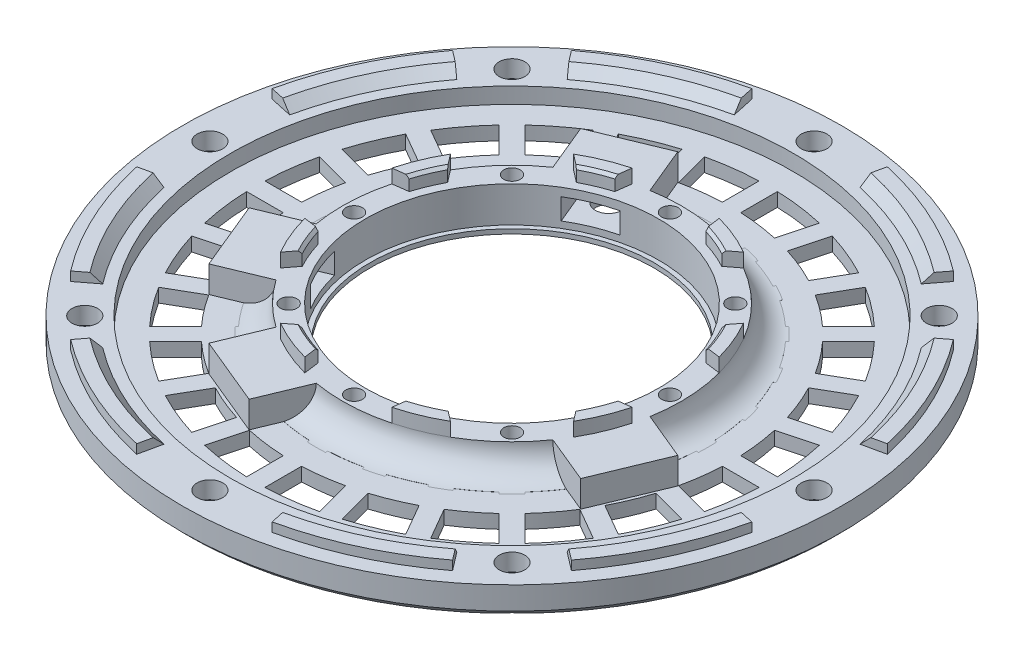
from build123d import *

# Parameters (mm, degrees)
SKETCH1_R                                         = 36
SKETCH1_R_2                                       = 16.025
BOSS_EXTRUDE1_DEPTH                               = 1
SKETCH2_R                                         = 18.5
SKETCH2_R_2                                       = 16.025
BOSS_EXTRUDE2_DEPTH                               = 3.9
FILLET1_R                                         = 2.9
BOSS_EXTRUDE3_START                               = -0.5
SKETCH4_R                                         = 36
SKETCH4_R_2                                       = 15.525
BOSS_EXTRUDE3_DEPTH                               = 0.5
CUT_EXTRUDE1_DEPTH                                = 51.994215358
CUT_EXTRUDE1_DEPTH_BACK                           = 51.994215358
SKETCH22_R                                        = 24.00781141
SKETCH22_R_2                                      = 21.15
BOSS_EXTRUDE10_DEPTH                              = 1.5
SKETCH7_R                                         = 0.9
CUT_EXTRUDE2_DEPTH                                = 52.101467689
SKETCH8_R                                         = 36
SKETCH8_R_2                                       = 30.75
BOSS_EXTRUDE4_DEPTH                               = 1.7378
BOSS_EXTRUDE5_DEPTH                               = 1
CIRPATTERN1_COUNT                                 = 4
CHAMFER1_SIZE                                     = 1
CUT_EXTRUDE3_DEPTH                                = 52.014540563
CUT_EXTRUDE3_DEPTH_BACK                           = 52.014540563
SKETCH10_R                                        = 1.4
CHAMFER2_SIZE                                     = 0.75
CSK_FOR_M2_5_FLAT_HEAD_MACHINE_SCREW1_D           = 2.7
CSK_FOR_M2_5_FLAT_HEAD_MACHINE_SCREW1_CSINK_D     = 5.5
CSK_FOR_M2_5_FLAT_HEAD_MACHINE_SCREW1_CSINK_ANGLE = 90
BOSS_EXTRUDE6_DEPTH                               = 1.5
CHAMFER3_SIZE                                     = 0.3
BOSS_EXTRUDE7_DEPTH                               = 2.9
SKETCH14_R                                        = 1.45
CUT_EXTRUDE4_DEPTH                                = 3.5
CUT_EXTRUDE7_DEPTH                                = 2.3


with BuildPart() as part:
    # Sketch1 → Boss-Extrude1 (new body)
    with BuildSketch(Plane(origin=(0, 0, 0), x_dir=(1, 0, 0), z_dir=(0, 1, 0))):
        with Locations(Location((0, 0, 0), (0, 0, 270))):
            Circle(SKETCH1_R)
        with Locations(Location((0, 0, 0), (0, 0, 270))):
            Circle(SKETCH1_R_2, mode=Mode.SUBTRACT)
    extrude(amount=BOSS_EXTRUDE1_DEPTH)

    # Sketch2 → Boss-Extrude2 (add)
    with BuildSketch(Plane.XZ):
        with Locations(Location((0, 0, 0), (0, 0, 270))):
            Circle(SKETCH2_R)
        with Locations(Location((0, 0, 0), (0, 0, 90))):
            Circle(SKETCH2_R_2, mode=Mode.SUBTRACT)
    extrude(amount=-BOSS_EXTRUDE2_DEPTH)

    # Fillet1
    fillet1_edges = [part.edges().sort_by_distance(p)[0] for p in [
        (0, 1, 18.5),
    ]]
    fillet(fillet1_edges, radius=FILLET1_R - 0.0001)  # a hair under: the kernel refuses the full size

    # Sketch4 → Boss-Extrude3 (add)
    with BuildSketch(Plane(origin=(0, 0, 0), x_dir=(1, 0, 0), z_dir=(0, 1, 0)).offset(BOSS_EXTRUDE3_START)):
        with Locations(Location((0, 0, 0), (0, 0, 270))):
            Circle(SKETCH4_R)
        with Locations(Location((0, 0, 0), (0, 0, 270))):
            Circle(SKETCH4_R_2, mode=Mode.SUBTRACT)
    extrude(amount=BOSS_EXTRUDE3_DEPTH)

    # Sketch5 → Cut-Extrude1 (cut, two sides: drawn at the far end of the back side and taken through both)
    with BuildSketch(Plane(origin=(0, 1, 0), x_dir=(1, 0, 0), z_dir=(0, 1, 0)).offset(-CUT_EXTRUDE1_DEPTH_BACK)):
        with BuildLine():
            Line((27.989953555, 1), (21.126346111, 1))
            ThreePointArc((21.126346111, 1), (20.969058818, 2.760628965), (20.665302369, 4.501974901))
            Line((20.665302369, 4.501974901), (27.29503806, 6.278407225))
            ThreePointArc((27.29503806, 6.278407225), (27.768200701, 3.655752976), (27.989953555, 1))
        make_face()
        with BuildLine():
            Line((27.989953555, -1), (21.126346111, -1))
            ThreePointArc((21.126346111, -1), (20.969058818, -2.760628965), (20.665302369, -4.501974901))
            Line((20.665302369, -4.501974901), (27.29503806, -6.278407225))
            ThreePointArc((27.29503806, -6.278407225), (27.768200701, -3.655752976), (27.989953555, -1))
        make_face()
        with BuildLine():
            Line((26.77739997, -8.210258878), (20.147664279, -6.433826553))
            ThreePointArc((20.147664279, -6.433826553), (19.540052113, -8.093754595), (18.795952421, -9.697147652))
            Line((18.795952421, -9.697147652), (24.740010829, -13.128951374))
            ThreePointArc((24.740010829, -13.128951374), (25.875843712, -10.718125404), (26.77739997, -8.210258878))
        make_face()
        with BuildLine():
            Line((23.740010829, -14.861002181), (17.795952421, -11.429198459))
            ThreePointArc((17.795952421, -11.429198459), (16.779423147, -12.875304224), (15.645689378, -14.231475816))
            Line((15.645689378, -14.231475816), (20.498992745, -19.084779183))
            ThreePointArc((20.498992745, -19.084779183), (22.220090737, -17.050075298), (23.740010829, -14.861002181))
        make_face()
        with BuildLine():
            Line((19.084779183, -20.498992745), (14.231475816, -15.645689378))
            ThreePointArc((14.231475816, -15.645689378), (12.875304224, -16.779423147), (11.429198459, -17.795952421))
            Line((11.429198459, -17.795952421), (14.861002181, -23.740010829))
            ThreePointArc((14.861002181, -23.740010829), (17.050075298, -22.220090737), (19.084779183, -20.498992745))
        make_face()
        with BuildLine():
            Line((13.128951374, -24.740010829), (9.697147652, -18.795952421))
            ThreePointArc((9.697147652, -18.795952421), (8.093754595, -19.540052113), (6.433826553, -20.147664279))
            Line((6.433826553, -20.147664279), (8.210258878, -26.77739997))
            ThreePointArc((8.210258878, -26.77739997), (10.718125404, -25.875843712), (13.128951374, -24.740010829))
        make_face()
        with BuildLine():
            Line((6.278407225, -27.29503806), (4.501974901, -20.665302369))
            ThreePointArc((4.501974901, -20.665302369), (2.760628965, -20.969058818), (1, -21.126346111))
            Line((1, -21.126346111), (1, -27.989953555))
            ThreePointArc((1, -27.989953555), (3.655752976, -27.768200701), (6.278407225, -27.29503806))
        make_face()
        with BuildLine():
            Line((-1, -27.989953555), (-1, -21.126346111))
            ThreePointArc((-1, -21.126346111), (-2.760628965, -20.969058818), (-4.501974901, -20.665302369))
            Line((-4.501974901, -20.665302369), (-6.278407225, -27.29503806))
            ThreePointArc((-6.278407225, -27.29503806), (-3.655752976, -27.768200701), (-1, -27.989953555))
        make_face()
        with BuildLine():
            Line((-8.210258878, -26.77739997), (-6.433826553, -20.147664279))
            ThreePointArc((-6.433826553, -20.147664279), (-8.093754595, -19.540052113), (-9.697147652, -18.795952421))
            Line((-9.697147652, -18.795952421), (-13.128951374, -24.740010829))
            ThreePointArc((-13.128951374, -24.740010829), (-10.718125404, -25.875843712), (-8.210258878, -26.77739997))
        make_face()
        with BuildLine():
            Line((-14.861002181, -23.740010829), (-11.429198459, -17.795952421))
            ThreePointArc((-11.429198459, -17.795952421), (-12.875304224, -16.779423147), (-14.231475816, -15.645689378))
            Line((-14.231475816, -15.645689378), (-19.084779183, -20.498992745))
            ThreePointArc((-19.084779183, -20.498992745), (-17.050075298, -22.220090737), (-14.861002181, -23.740010829))
        make_face()
        with BuildLine():
            Line((-20.498992745, -19.084779183), (-15.645689378, -14.231475816))
            ThreePointArc((-15.645689378, -14.231475816), (-16.779423147, -12.875304224), (-17.795952421, -11.429198459))
            Line((-17.795952421, -11.429198459), (-23.740010829, -14.861002181))
            ThreePointArc((-23.740010829, -14.861002181), (-22.220090737, -17.050075298), (-20.498992745, -19.084779183))
        make_face()
        with BuildLine():
            Line((-24.740010829, -13.128951374), (-18.795952421, -9.697147652))
            ThreePointArc((-18.795952421, -9.697147652), (-19.540052113, -8.093754595), (-20.147664279, -6.433826553))
            Line((-20.147664279, -6.433826553), (-26.77739997, -8.210258878))
            ThreePointArc((-26.77739997, -8.210258878), (-25.875843712, -10.718125404), (-24.740010829, -13.128951374))
        make_face()
        with BuildLine():
            Line((-27.29503806, -6.278407225), (-20.665302369, -4.501974901))
            ThreePointArc((-20.665302369, -4.501974901), (-20.969058818, -2.760628965), (-21.126346111, -1))
            Line((-21.126346111, -1), (-27.989953555, -1))
            ThreePointArc((-27.989953555, -1), (-27.768200701, -3.655752976), (-27.29503806, -6.278407225))
        make_face()
        with BuildLine():
            Line((-27.989953555, 1), (-21.126346111, 1))
            ThreePointArc((-21.126346111, 1), (-20.969058818, 2.760628965), (-20.665302369, 4.501974901))
            Line((-20.665302369, 4.501974901), (-27.29503806, 6.278407225))
            ThreePointArc((-27.29503806, 6.278407225), (-27.768200701, 3.655752976), (-27.989953555, 1))
        make_face()
        with BuildLine():
            Line((-26.77739997, 8.210258878), (-20.147664279, 6.433826553))
            ThreePointArc((-20.147664279, 6.433826553), (-19.540052113, 8.093754595), (-18.795952421, 9.697147652))
            Line((-18.795952421, 9.697147652), (-24.740010829, 13.128951374))
            ThreePointArc((-24.740010829, 13.128951374), (-25.875843712, 10.718125404), (-26.77739997, 8.210258878))
        make_face()
        with BuildLine():
            Line((-23.740010829, 14.861002181), (-17.795952421, 11.429198459))
            ThreePointArc((-17.795952421, 11.429198459), (-16.779423147, 12.875304224), (-15.645689378, 14.231475816))
            Line((-15.645689378, 14.231475816), (-20.498992745, 19.084779183))
            ThreePointArc((-20.498992745, 19.084779183), (-22.220090737, 17.050075298), (-23.740010829, 14.861002181))
        make_face()
        with BuildLine():
            Line((-19.084779183, 20.498992745), (-14.231475816, 15.645689378))
            ThreePointArc((-14.231475816, 15.645689378), (-12.875304224, 16.779423147), (-11.429198459, 17.795952421))
            Line((-11.429198459, 17.795952421), (-14.861002181, 23.740010829))
            ThreePointArc((-14.861002181, 23.740010829), (-17.050075298, 22.220090737), (-19.084779183, 20.498992745))
        make_face()
        with BuildLine():
            Line((-13.128951374, 24.740010829), (-9.697147652, 18.795952421))
            ThreePointArc((-9.697147652, 18.795952421), (-8.093754595, 19.540052113), (-6.433826553, 20.147664279))
            Line((-6.433826553, 20.147664279), (-8.210258878, 26.77739997))
            ThreePointArc((-8.210258878, 26.77739997), (-10.718125404, 25.875843712), (-13.128951374, 24.740010829))
        make_face()
        with BuildLine():
            Line((-6.278407225, 27.29503806), (-4.501974901, 20.665302369))
            ThreePointArc((-4.501974901, 20.665302369), (-2.760628965, 20.969058818), (-1, 21.126346111))
            Line((-1, 21.126346111), (-1, 27.989953555))
            ThreePointArc((-1, 27.989953555), (-3.655752976, 27.768200701), (-6.278407225, 27.29503806))
        make_face()
        with BuildLine():
            Line((1, 27.989953555), (1, 21.126346111))
            ThreePointArc((1, 21.126346111), (2.760628965, 20.969058818), (4.501974901, 20.665302369))
            Line((4.501974901, 20.665302369), (6.278407225, 27.29503806))
            ThreePointArc((6.278407225, 27.29503806), (3.655752976, 27.768200701), (1, 27.989953555))
        make_face()
        with BuildLine():
            Line((8.210258878, 26.77739997), (6.433826553, 20.147664279))
            ThreePointArc((6.433826553, 20.147664279), (8.093754595, 19.540052113), (9.697147652, 18.795952421))
            Line((9.697147652, 18.795952421), (13.128951374, 24.740010829))
            ThreePointArc((13.128951374, 24.740010829), (10.718125404, 25.875843712), (8.210258878, 26.77739997))
        make_face()
        with BuildLine():
            Line((14.861002181, 23.740010829), (11.429198459, 17.795952421))
            ThreePointArc((11.429198459, 17.795952421), (12.875304224, 16.779423147), (14.231475816, 15.645689378))
            Line((14.231475816, 15.645689378), (19.084779183, 20.498992745))
            ThreePointArc((19.084779183, 20.498992745), (17.050075298, 22.220090737), (14.861002181, 23.740010829))
        make_face()
        with BuildLine():
            Line((20.498992745, 19.084779183), (15.645689378, 14.231475816))
            ThreePointArc((15.645689378, 14.231475816), (16.779423147, 12.875304224), (17.795952421, 11.429198459))
            Line((17.795952421, 11.429198459), (23.740010829, 14.861002181))
            ThreePointArc((23.740010829, 14.861002181), (22.220090737, 17.050075298), (20.498992745, 19.084779183))
        make_face()
        with BuildLine():
            Line((24.740010829, 13.128951374), (18.795952421, 9.697147652))
            ThreePointArc((18.795952421, 9.697147652), (19.540052113, 8.093754595), (20.147664279, 6.433826553))
            Line((20.147664279, 6.433826553), (26.77739997, 8.210258878))
            ThreePointArc((26.77739997, 8.210258878), (25.875843712, 10.718125404), (24.740010829, 13.128951374))
        make_face()
    extrude(amount=CUT_EXTRUDE1_DEPTH + CUT_EXTRUDE1_DEPTH_BACK, mode=Mode.SUBTRACT)

    # Sketch22 → Boss-Extrude10 (add)
    with BuildSketch(Plane.XZ.offset(0.5)):
        Circle(SKETCH22_R)
        Circle(SKETCH22_R_2, mode=Mode.SUBTRACT)
    extrude(amount=-BOSS_EXTRUDE10_DEPTH)

    # Sketch7 → Cut-Extrude2 (cut, through all)
    with BuildSketch(Plane(origin=(0, 3.9, 0), x_dir=(1, 0, 0), z_dir=(0, 1, 0))):
        with Locations(Location((0, 17.25, 0), (0, 0, 270))):
            Circle(SKETCH7_R)
        with Locations(Location((12.197591975, 12.197591975, 0), (0, 0, 270))):
            Circle(SKETCH7_R)
        with Locations(Location((17.25, 0, 0), (0, 0, 270))):
            Circle(SKETCH7_R)
        with Locations(Location((12.197591975, -12.197591975, 0), (0, 0, 270))):
            Circle(SKETCH7_R)
        with Locations(Location((0, -17.25, 0), (0, 0, 270))):
            Circle(SKETCH7_R)
        with Locations(Location((-12.197591975, -12.197591975, 0), (0, 0, 270))):
            Circle(SKETCH7_R)
        with Locations(Location((-17.25, 0, 0), (0, 0, 270))):
            Circle(SKETCH7_R)
        with Locations(Location((-12.197591975, 12.197591975, 0), (0, 0, 270))):
            Circle(SKETCH7_R)
    extrude(amount=-CUT_EXTRUDE2_DEPTH, mode=Mode.SUBTRACT)

    # Sketch8 → Boss-Extrude4 (add)
    with BuildSketch(Plane(origin=(0, 1, 0), x_dir=(1, 0, 0), z_dir=(0, 1, 0))):
        with Locations(Location((0, 0, 0), (0, 0, 270))):
            Circle(SKETCH8_R)
        with Locations(Location((0, 0, 0), (0, 0, 270))):
            Circle(SKETCH8_R_2, mode=Mode.SUBTRACT)
    extrude(amount=BOSS_EXTRUDE4_DEPTH)

    # Sketch9 → Boss-Extrude5 (add)
    with BuildSketch(Plane(origin=(0, 2.7378, 0), x_dir=(1, 0, 0), z_dir=(0, 1, 0))):
        with BuildLine():
            Line((-27.352115736, 20.861969341), (-25.368732385, 19.340065768))
            ThreePointArc((-25.368732385, 19.340065768), (-28.940572033, 13.418420813), (-31.152312489, 6.866160013))
            Line((-31.152312489, 6.866160013), (-33.595390255, 7.396604193))
            ThreePointArc((-33.595390255, 7.396604193), (-31.208630798, 14.470016024), (-27.352115736, 20.861969341))
        make_face()
        with BuildLine():
            Line((-7.396604193, 33.595390255), (-6.866160013, 31.152312489))
            ThreePointArc((-6.866160013, 31.152312489), (-13.418420813, 28.940572033), (-19.340065768, 25.368732385))
            Line((-19.340065768, 25.368732385), (-20.861969341, 27.352115736))
            ThreePointArc((-20.861969341, 27.352115736), (-14.470016024, 31.208630798), (-7.396604193, 33.595390255))
        make_face()
    boss_extrude5 = extrude(amount=BOSS_EXTRUDE5_DEPTH)

    # CirPattern1: Boss-Extrude5 ×4 about axis
    cirpattern1_axis = Axis((0, 0, 0), (0, 1, 0))
    for i in range(1, CIRPATTERN1_COUNT):
        add(boss_extrude5.rotate(cirpattern1_axis, i * 360 / CIRPATTERN1_COUNT))

    # Chamfer1
    chamfer1_edges = [part.edges().sort_by_distance(p)[0] for p in [
        (-28.940572033, 3.7378, -13.418420813),
        (-13.418420813, 3.7378, -28.940572033),
        (13.418420813, 3.7378, -28.940572033),
        (28.940572033, 3.7378, -13.418420813),
        (28.940572033, 3.7378, 13.418420813),
        (13.418420813, 3.7378, 28.940572033),
        (-13.418420813, 3.7378, 28.940572033),
        (-28.940572033, 3.7378, 13.418420813),
    ]]
    chamfer(chamfer1_edges, length=CHAMFER1_SIZE - 0.0001)  # a hair under: the kernel refuses the full size

    # Sketch10 → Cut-Extrude3 (cut, two sides: drawn at the far end of the back side and taken through both)
    with BuildSketch(Plane(origin=(0, 2.7378, 0), x_dir=(1, 0, 0), z_dir=(0, 1, 0)).offset(-CUT_EXTRUDE3_DEPTH_BACK)):
        with Locations(Location((0, 33, 0), (0, 0, 270))):
            Circle(SKETCH10_R)
        with Locations(Location((23.334523779, 23.334523779, 0), (0, 0, 270))):
            Circle(SKETCH10_R)
        with Locations(Location((33, 0, 0), (0, 0, 270))):
            Circle(SKETCH10_R)
        with Locations(Location((23.334523779, -23.334523779, 0), (0, 0, 270))):
            Circle(SKETCH10_R)
        with Locations(Location((0, -33, 0), (0, 0, 270))):
            Circle(SKETCH10_R)
        with Locations(Location((-23.334523779, -23.334523779, 0), (0, 0, 270))):
            Circle(SKETCH10_R)
        with Locations(Location((-33, 0, 0), (0, 0, 270))):
            Circle(SKETCH10_R)
        with Locations(Location((-23.334523779, 23.334523779, 0), (0, 0, 270))):
            Circle(SKETCH10_R)
    extrude(amount=CUT_EXTRUDE3_DEPTH + CUT_EXTRUDE3_DEPTH_BACK, mode=Mode.SUBTRACT)

    # Chamfer2
    chamfer2_edges = [part.edges().sort_by_distance(p)[0] for p in [
        (0, -0.5, -36),
    ]]
    chamfer(chamfer2_edges, length=CHAMFER2_SIZE)

    # CSK for M2.5 Flat Head Machine Screw1 (through all)
    with Locations(Plane(origin=(0, -0.5, 0), x_dir=(-1, 0, 0), z_dir=(0, -1, 0))):
        with Locations((0, -33), (23.334523779, -23.334523779), (33, 0), (23.334523779, 23.334523779), (0, 33), (-23.334523779, 23.334523779), (-33, 0), (-23.334523779, -23.334523779)):
            CounterSinkHole(CSK_FOR_M2_5_FLAT_HEAD_MACHINE_SCREW1_D / 2, CSK_FOR_M2_5_FLAT_HEAD_MACHINE_SCREW1_CSINK_D / 2, counter_sink_angle=CSK_FOR_M2_5_FLAT_HEAD_MACHINE_SCREW1_CSINK_ANGLE)

    # Sketch13 → Boss-Extrude6 (add)
    with BuildSketch(Plane(origin=(0, 3.9, 0), x_dir=(1, 0, 0), z_dir=(0, 1, 0))):
        with BuildLine():
            Line((-9.280791103, 16.003653223), (-7.940345472, 14.975093114))
            ThreePointArc((-7.940345472, 14.975093114), (-6.486484179, 15.659758076), (-4.974317762, 16.203662018))
            Line((-4.974317762, 16.203662018), (-4.753781394, 17.878802042))
            ThreePointArc((-4.753781394, 17.878802042), (-7.079643499, 17.091771351), (-9.280791103, 16.003653223))
        make_face()
        with BuildLine():
            Line((4.753781394, 17.878802042), (4.974317762, 16.203662018))
            ThreePointArc((4.974317762, 16.203662018), (6.486484179, 15.659758076), (7.940345472, 14.975093114))
            Line((7.940345472, 14.975093114), (9.280791103, 16.003653223))
            ThreePointArc((9.280791103, 16.003653223), (7.079643499, 17.091771351), (4.753781394, 17.878802042))
        make_face()
        with BuildLine():
            Line((16.003653223, 9.280791103), (14.975093114, 7.940345472))
            ThreePointArc((14.975093114, 7.940345472), (15.659758076, 6.486484179), (16.203662018, 4.974317762))
            Line((16.203662018, 4.974317762), (17.878802042, 4.753781394))
            ThreePointArc((17.878802042, 4.753781394), (17.091771351, 7.079643499), (16.003653223, 9.280791103))
        make_face()
        with BuildLine():
            Line((17.878802042, -4.753781394), (16.203662018, -4.974317762))
            ThreePointArc((16.203662018, -4.974317762), (15.659758076, -6.486484179), (14.975093114, -7.940345472))
            Line((14.975093114, -7.940345472), (16.003653223, -9.280791103))
            ThreePointArc((16.003653223, -9.280791103), (17.091771351, -7.079643499), (17.878802042, -4.753781394))
        make_face()
        with BuildLine():
            Line((9.280791103, -16.003653223), (7.940345472, -14.975093114))
            ThreePointArc((7.940345472, -14.975093114), (6.486484179, -15.659758076), (4.974317762, -16.203662018))
            Line((4.974317762, -16.203662018), (4.753781394, -17.878802042))
            ThreePointArc((4.753781394, -17.878802042), (7.079643499, -17.091771351), (9.280791103, -16.003653223))
        make_face()
        with BuildLine():
            Line((-4.753781394, -17.878802042), (-4.974317762, -16.203662018))
            ThreePointArc((-4.974317762, -16.203662018), (-6.486484179, -15.659758076), (-7.940345472, -14.975093114))
            Line((-7.940345472, -14.975093114), (-9.280791103, -16.003653223))
            ThreePointArc((-9.280791103, -16.003653223), (-7.079643499, -17.091771351), (-4.753781394, -17.878802042))
        make_face()
        with BuildLine():
            Line((-16.003653223, -9.280791103), (-14.975093114, -7.940345472))
            ThreePointArc((-14.975093114, -7.940345472), (-15.659758076, -6.486484179), (-16.203662018, -4.974317762))
            Line((-16.203662018, -4.974317762), (-17.878802042, -4.753781394))
            ThreePointArc((-17.878802042, -4.753781394), (-17.091771351, -7.079643499), (-16.003653223, -9.280791103))
        make_face()
        with BuildLine():
            Line((-17.878802042, 4.753781394), (-16.203662018, 4.974317762))
            ThreePointArc((-16.203662018, 4.974317762), (-15.659758076, 6.486484179), (-14.975093114, 7.940345472))
            Line((-14.975093114, 7.940345472), (-16.003653223, 9.280791103))
            ThreePointArc((-16.003653223, 9.280791103), (-17.091771351, 7.079643499), (-17.878802042, 4.753781394))
        make_face()
    extrude(amount=BOSS_EXTRUDE6_DEPTH)

    # Chamfer3
    chamfer3_edges = [part.edges().sort_by_distance(p)[0] for p in [
        (-6.486484179, 5.4, -15.659758076),
        (6.486484179, 5.4, -15.659758076),
        (15.659758076, 5.4, -6.486484179),
        (15.659758076, 5.4, 6.486484179),
        (6.486484179, 5.4, 15.659758076),
        (-6.486484179, 5.4, 15.659758076),
        (-15.659758076, 5.4, 6.486484179),
        (-15.659758076, 5.4, -6.486484179),
    ]]
    chamfer(chamfer3_edges, length=CHAMFER3_SIZE)

    # Sketch15 → Boss-Extrude7 (add)
    with BuildSketch(Plane(origin=(0, 1, 0), x_dir=(1, 0, 0), z_dir=(0, 1, 0))):
        Polygon((-9.882502004, 13.25186865), (-12.805132369, 20.307722515), (-5.305132369, 23.414324233), (-2.382502004, 16.358470367), align=None)
        Polygon((16.358470367, -2.382502004), (23.414324233, -5.305132369), (20.307722515, -12.805132369), (13.25186865, -9.882502004), align=None)
        Polygon((-2.382502004, -16.358470367), (-5.305132369, -23.414324233), (-12.805132369, -20.307722515), (-9.882502004, -13.25186865), align=None)
        Polygon((-13.25186865, -9.882502004), (-20.307722515, -12.805132369), (-23.414324233, -5.305132369), (-16.358470367, -2.382502004), align=None)
    extrude(amount=BOSS_EXTRUDE7_DEPTH)

    # Sketch14 → Cut-Extrude4 (cut)
    with BuildSketch(Plane.XZ.offset(0.5)):
        with Locations(Location((-18.015650884, 7.462326931, 0), (0, 0, 270))):
            Circle(SKETCH14_R)
        with Locations(Location((-7.462326931, -18.015650884, 0), (0, 0, 270))):
            Circle(SKETCH14_R)
        with Locations(Location((18.015650884, 7.462326931, 0), (0, 0, 90))):
            Circle(SKETCH14_R)
        with Locations(Location((-7.462326931, 18.015650884, 0), (0, 0, 90))):
            Circle(SKETCH14_R)
    extrude(amount=-CUT_EXTRUDE4_DEPTH, mode=Mode.SUBTRACT)

    # Sketch20 → Cut-Extrude7 (cut)
    with BuildSketch(Plane.XZ.offset(-3)):
        Polygon((-15.771241338, 9.184522948), (-13.693542771, 8.323912023), (-15.56869159, 3.796902314), (-17.646390156, 4.657513239), (-20.26006043, 5.740130914), (-20.629321158, 8.544944606), (-18.384911612, 10.267140623), align=None)
        Polygon((-8.323912023, 13.693542771), (-9.184522948, 15.771241338), (-10.267140623, 18.384911612), (-8.544944606, 20.629321158), (-5.740130914, 20.26006043), (-4.657513239, 17.646390156), (-3.796902314, 15.56869159), align=None)
        Polygon((13.693542771, 8.323912023), (15.771241338, 9.184522948), (18.384911612, 10.267140623), (20.629321158, 8.544944606), (20.26006043, 5.740130914), (17.646390156, 4.657513239), (15.56869159, 3.796902314), align=None)
        Polygon((-3.796902314, -15.56869159), (-4.657513239, -17.646390156), (-5.740130914, -20.26006043), (-8.544944606, -20.629321158), (-10.267140623, -18.384911612), (-9.184522948, -15.771241338), (-8.323912023, -13.693542771), align=None)
    extrude(amount=CUT_EXTRUDE7_DEPTH, mode=Mode.SUBTRACT)


solid = part.part
